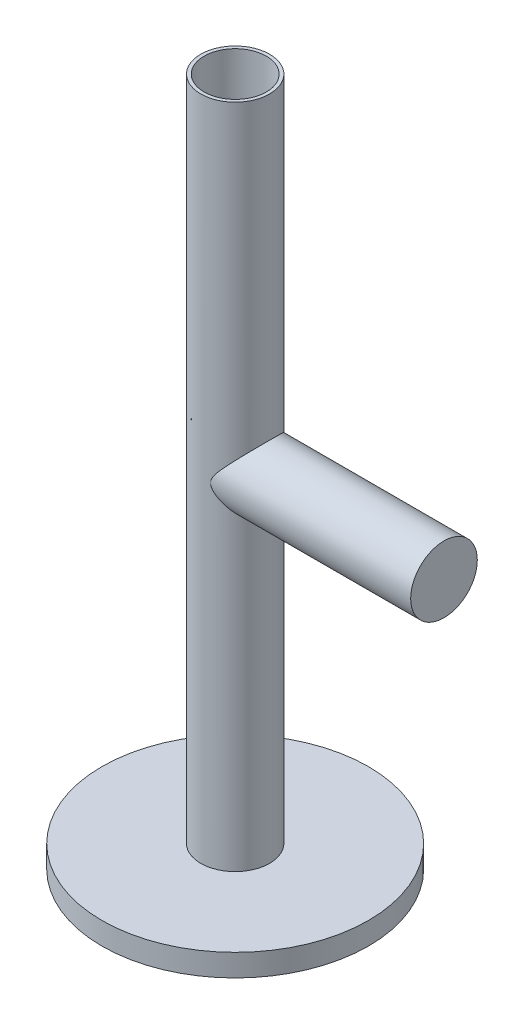
from build123d import *

# Parameters (mm, degrees)
SKETCH1_R               = 7.75
SKETCH1_R_2             = 7
BOSS_EXTRUDE1_DEPTH     = 150
SKETCH2_R               = 30
BOSS_EXTRUDE2_DEPTH     = 5
SKETCH5_R               = 7.5
BOSS_EXTRUDE3_DEPTH     = 47
CUT_EXTRUDE2_DEPTH      = 10
CUT_EXTRUDE2_DEPTH_BACK = 170
SKETCH6_R               = 7


with BuildPart() as part:
    # Sketch1 → Boss-Extrude1 (new body)
    with BuildSketch(Plane(origin=(0, 0, 0), x_dir=(1, 0, 0), z_dir=(0, 1, 0))):
        Circle(SKETCH1_R)
        Circle(SKETCH1_R_2, mode=Mode.SUBTRACT)
    extrude(amount=BOSS_EXTRUDE1_DEPTH)

    # Sketch2 → Boss-Extrude2 (add)
    with BuildSketch(Plane.XZ):
        Circle(SKETCH2_R)
    extrude(amount=BOSS_EXTRUDE2_DEPTH)

    # Sketch5 → Boss-Extrude3 (add)
    with BuildSketch(Plane(origin=(0, 0, 0), x_dir=(0, 0, -1), z_dir=(1, 0, 0))):
        with Locations((0, 75)):
            Circle(SKETCH5_R)
    extrude(amount=BOSS_EXTRUDE3_DEPTH)

    # Sketch6 → Cut-Extrude2 (cut, two sides: drawn at the far end of the back side and taken through both)
    with BuildSketch(Plane(origin=(0, -5, 0), x_dir=(-1, 0, 0), z_dir=(0, -1, 0)).offset(-CUT_EXTRUDE2_DEPTH_BACK)):
        Circle(SKETCH6_R)
    extrude(amount=CUT_EXTRUDE2_DEPTH + CUT_EXTRUDE2_DEPTH_BACK, mode=Mode.SUBTRACT)


solid = part.part
